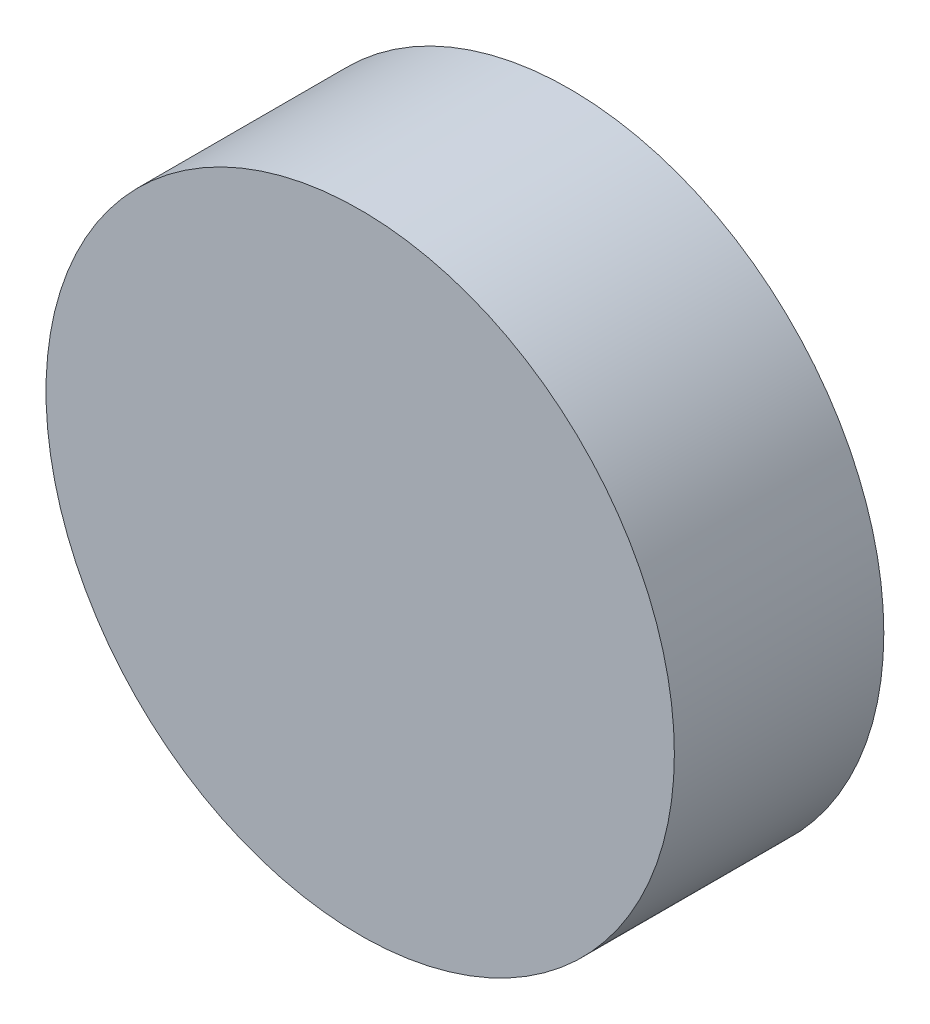
from build123d import *

# Parameters (mm, degrees)
SKETCH_1_R      = 15
EXTRUDE_1_DEPTH = 10


with BuildPart() as part:
    # 草图1 → 凸台-拉伸1 (new body)
    with BuildSketch(Plane.XY):
        Circle(SKETCH_1_R)
    extrude(amount=EXTRUDE_1_DEPTH)


solid = part.part
